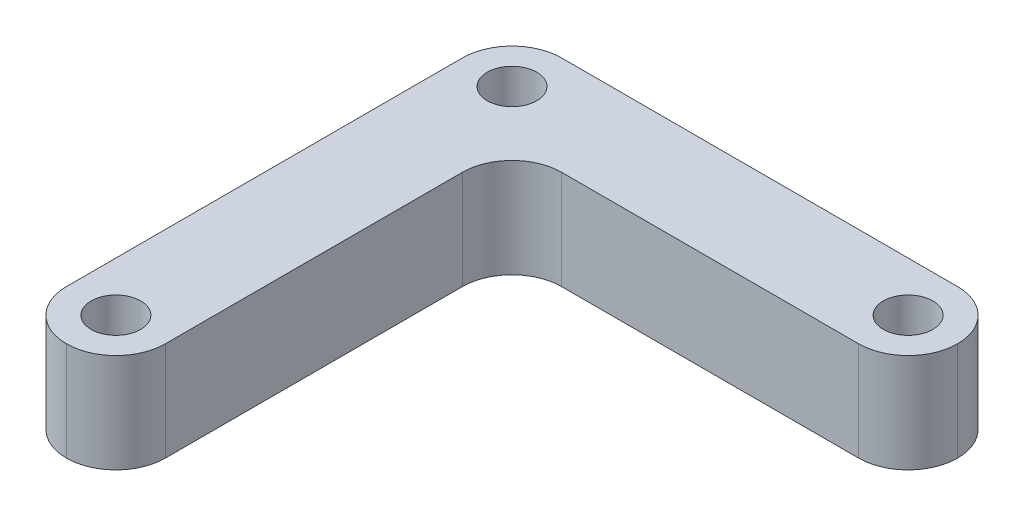
from build123d import *

# Parameters (mm, degrees)
SKETCH1_W           = 25
SKETCH1_H           = 25
BOSS_EXTRUDE1_DEPTH = 5
SKETCH3_R           = 1.25
CUT_EXTRUDE1_DEPTH  = 19.371173071
SKETCH4_W           = 20
SKETCH4_H           = 20
CUT_EXTRUDE2_DEPTH  = 19.371173071
FILLET1_R           = 2.5


with BuildPart() as part:
    # Sketch1 → Boss-Extrude1 (new body)
    with BuildSketch(Plane(origin=(0, 0, 0), x_dir=(1, 0, 0), z_dir=(0, 1, 0))):
        Rectangle(SKETCH1_W, SKETCH1_H)
    extrude(amount=BOSS_EXTRUDE1_DEPTH)

    # Sketch3 → Cut-Extrude1 (cut, through all)
    with BuildSketch(Plane(origin=(0, 5, 0), x_dir=(1, 0, 0), z_dir=(0, 1, 0))):
        with Locations(Location((-10, 10, 0), (0, 0, 270))):
            Circle(SKETCH3_R)
        with Locations(Location((10, 10, 0), (0, 0, 270))):
            Circle(SKETCH3_R)
        with Locations(Location((-10, -10, 0), (0, 0, 270))):
            Circle(SKETCH3_R)
    extrude(amount=-CUT_EXTRUDE1_DEPTH, mode=Mode.SUBTRACT)

    # Sketch4 → Cut-Extrude2 (cut, through all)
    with BuildSketch(Plane(origin=(0, 5, 0), x_dir=(1, 0, 0), z_dir=(0, 1, 0))):
        with Locations((2.5, -2.5)):
            Rectangle(SKETCH4_W, SKETCH4_H)
    extrude(amount=-CUT_EXTRUDE2_DEPTH, mode=Mode.SUBTRACT)

    # Fillet1
    fillet1_edges = [part.edges().sort_by_distance(p)[0] for p in [
        (-12.5, 2.5, 12.5),
        (12.5, 2.5, -12.5),
        (-12.5, 2.5, -12.5),
        (12.5, 2.5, -7.5),
        (-7.5, 2.5, 12.5),
        (-7.5, 2.5, -7.5),
    ]]
    fillet(fillet1_edges, radius=FILLET1_R - 0.0001)  # a hair under: the kernel refuses the full size


solid = part.part
